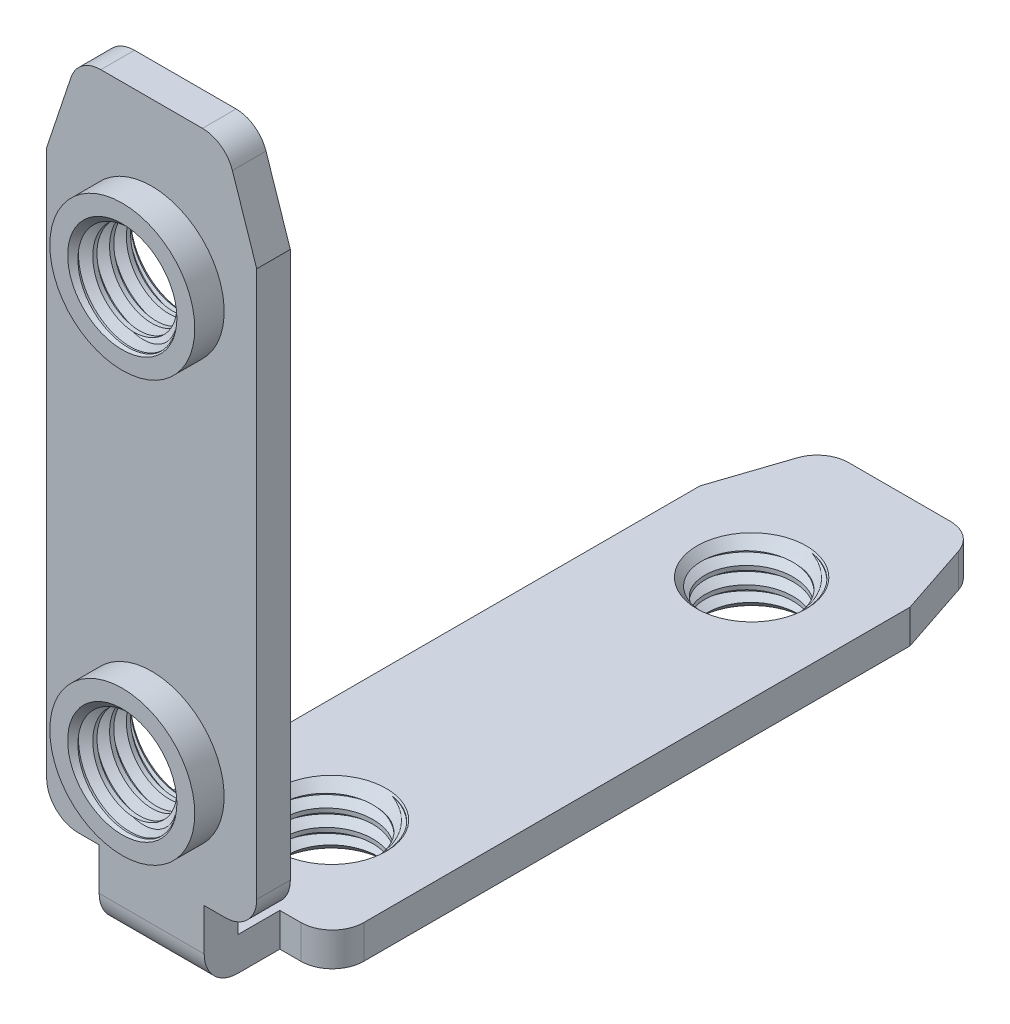
from build123d import *

# Parameters (mm, degrees)
BOSS_EXTRUDE1_DEPTH      = 1.6
SKETCH2_R                = 3.45
BOSS_EXTRUDE2_DEPTH      = 1.4
SKETCH10_R               = 2.1
CUT_EXTRUDE1_DEPTH       = 35.496376621
CHAMFER1_SIZE            = 0.5
BOSS_EXTRUDE3_DEPTH      = 5
CHAMFER1_OF_MIRROR4_SIZE = 0.5
THREAD1_PITCH            = 0.8
THREAD2_PITCH            = 0.8
THREAD3_PITCH            = 0.8
THREAD4_PITCH            = 0.8


with BuildPart() as part:
    # Sketch1 → Boss-Extrude1 (new body)
    with BuildSketch(Plane.XY):
        with BuildLine():
            Line((-3.5, 2), (-2.5, 2))
            Line((-2.5, 2), (-2.5, 0))
            Line((-2.5, 0), (2.5, 0))
            Line((2.5, 0), (2.5, 2))
            Line((2.5, 2), (3.5, 2))
            ThreePointArc((3.5, 2), (4.560660172, 2.439339828), (5, 3.5))
            Line((5, 3.5), (5, 29.5))
            Line((5, 29.5), (3.841886117, 32.974341649))
            ThreePointArc((3.841886117, 32.974341649), (3.295926597, 33.716863278), (2.41886117, 34))
            Line((2.41886117, 34), (-2.41886117, 34))
            ThreePointArc((-2.41886117, 34), (-3.295926597, 33.716863278), (-3.841886117, 32.974341649))
            Line((-3.841886117, 32.974341649), (-5, 29.5))
            Line((-5, 29.5), (-5, 3.5))
            ThreePointArc((-5, 3.5), (-4.560660172, 2.439339828), (-3.5, 2))
        make_face()
    boss_extrude1 = extrude(amount=BOSS_EXTRUDE1_DEPTH)

    # Sketch2 → Boss-Extrude2 (add)
    with BuildSketch(Plane.XY.offset(1.6)):
        with Locations(Location((0, 6.96, 0), (0, 0, 180))):
            Circle(SKETCH2_R)
        with Locations(Location((0, 26.96, 0), (0, 0, 180))):
            Circle(SKETCH2_R)
    boss_extrude2 = extrude(amount=BOSS_EXTRUDE2_DEPTH)

    # Sketch10 → Cut-Extrude1 (cut, through all)
    with BuildSketch(Plane.XY.offset(3)):
        with Locations((0, 6.96)):
            Circle(SKETCH10_R)
        with Locations((0, 26.96)):
            Circle(SKETCH10_R)
    cut_extrude1 = extrude(amount=-CUT_EXTRUDE1_DEPTH, mode=Mode.SUBTRACT)

    # Chamfer1
    chamfer1_edges = [part.edges().sort_by_distance(p)[0] for p in [
        (-2.1, 6.96, 0),
        (-2.1, 6.96, 3),
        (-2.1, 26.96, 0),
        (-2.1, 26.96, 3),
    ]]
    chamfer(chamfer1_edges, length=CHAMFER1_SIZE)

    # Sketch5 → Boss-Extrude3 (add)
    with BuildSketch(Plane(origin=(2.5, 0, 0), x_dir=(0, 0, -1), z_dir=(1, 0, 0))):
        with BuildLine():
            Line((0, 0), (-1.6, 0))
            ThreePointArc((-1.6, 0), (-1.13137085, -1.13137085), (0, -1.6))
            Line((0, -1.6), (0, 0))
        make_face()
    extrude(amount=-BOSS_EXTRUDE3_DEPTH)

    # Mirror4: Boss-Extrude1, Boss-Extrude2, Cut-Extrude1 across plane
    add(boss_extrude1.mirror(Plane(origin=(0, 0, 0), x_dir=(0, -0.7071067811865465, 0.7071067811865486), z_dir=(0, -0.7071067811865488, -0.7071067811865464))))
    add(boss_extrude2.mirror(Plane(origin=(0, 0, 0), x_dir=(0, -0.7071067811865465, 0.7071067811865486), z_dir=(0, -0.7071067811865488, -0.7071067811865464))))
    add(cut_extrude1.mirror(Plane(origin=(0, 0, 0), x_dir=(0, -0.7071067811865465, 0.7071067811865486), z_dir=(0, -0.7071067811865488, -0.7071067811865464))), mode=Mode.SUBTRACT)

    # Chamfer1 of Mirror4
    chamfer1_of_mirror4_edges = [part.edges().sort_by_distance(p)[0] for p in [
        (-2.1, 0, -6.96),
        (-2.1, -3, -6.96),
        (-2.1, 0, -26.96),
        (-2.1, -3, -26.96),
    ]]
    chamfer(chamfer1_of_mirror4_edges, length=CHAMFER1_OF_MIRROR4_SIZE)

    # Thread1: arcs per turn and ends read off the stored shape
    # Thread1: the profile of Thread Profile2 profile screwed along a right-hand helix through 6.25 turns, 8 arcs to a turn; built about Z, then put on its axis
    thread1_z = Axis((0, 0, 0), (0, 0, 1))
    thread1_corners = [(2.0997, 0, -0.000173205), (2.5330127, 0, 0.249999999), (2.5330127, 0, 0.349999999), (2.0997, 0, 0.600173203)]
    with BuildLine(mode=Mode.PRIVATE) as thread1_profile:
        Line(thread1_corners[0], thread1_corners[1])
        Line(thread1_corners[1], thread1_corners[2])
        Line(thread1_corners[2], thread1_corners[3])
        Line(thread1_corners[3], thread1_corners[0])
    thread1_cap = Face(thread1_profile.wire())
    thread1_turn_angles = [0, 22.5, 45, 67.5, 90, 112.5, 135, 157.5, 180, 202.5, 225, 247.5, 270, 292.5, 315, 337.5, 360]
    thread1_turn_weights = [1, 0.9238795325112867, 1, 0.9238795325112867, 1, 0.9238795325112867, 1, 0.9238795325112867, 1, 0.9238795325112867, 1, 0.9238795325112867, 1, 0.9238795325112867, 1, 0.9238795325112867, 1]
    thread1_turn_rails = [Edge.make_bspline([Vector(p[0], p[1], 0).rotate(thread1_z, thread1_turn_angles[k]) / thread1_turn_weights[k] + Vector(0, 0, p[2] + THREAD1_PITCH * thread1_turn_angles[k] / 360) for k in range(17)], [0, 0, 0, 1, 1, 2, 2, 3, 3, 4, 4, 5, 5, 6, 6, 7, 7, 8, 8, 8], 2, thread1_turn_weights) for p in thread1_corners]
    thread1_turn_sides = [Face.make_surface_from_curves(thread1_turn_rails[p[0]], thread1_turn_rails[p[1]]) for p in [(0, 1), (1, 2), (2, 3), (3, 0)]]
    thread1_last_angles = [2160, 2182.5, 2205, 2227.5, 2250]
    thread1_last_weights = [1, 0.9238795325112867, 1, 0.9238795325112867, 1]
    thread1_last_rails = [Edge.make_bspline([Vector(p[0], p[1], 0).rotate(thread1_z, thread1_last_angles[k]) / thread1_last_weights[k] + Vector(0, 0, p[2] + THREAD1_PITCH * thread1_last_angles[k] / 360) for k in range(5)], [0, 0, 0, 1, 1, 2, 2, 2], 2, thread1_last_weights) for p in thread1_corners]
    thread1_last_sides = [Face.make_surface_from_curves(thread1_last_rails[p[0]], thread1_last_rails[p[1]]) for p in [(0, 1), (1, 2), (2, 3), (3, 0)]]
    thread1 = Plane(origin=(0, 26.96, -0.5), x_dir=(1, 0, 0), z_dir=(0, 0, 1)) * Solid(Shell([*[p.moved(Location((0, 0, THREAD1_PITCH * i))) for i in range(6) for p in thread1_turn_sides], *thread1_last_sides, thread1_cap, thread1_cap.rotate(thread1_z, 2250).moved(Location((0, 0, THREAD1_PITCH * 2250 / 360)))]))
    add(thread1, mode=Mode.SUBTRACT)

    # Thread2: arcs per turn and ends read off the stored shape
    # Thread2: the profile of Thread Profile3 profile screwed along a right-hand helix through 6.25 turns, 8 arcs to a turn; built about Z, then put on its axis
    thread2_z = Axis((0, 0, 0), (0, 0, 1))
    thread2_corners = [(2.0997, 0, -0.000173205), (2.5330127, 0, 0.249999999), (2.5330127, 0, 0.349999999), (2.0997, 0, 0.600173203)]
    with BuildLine(mode=Mode.PRIVATE) as thread2_profile:
        Line(thread2_corners[0], thread2_corners[1])
        Line(thread2_corners[1], thread2_corners[2])
        Line(thread2_corners[2], thread2_corners[3])
        Line(thread2_corners[3], thread2_corners[0])
    thread2_cap = Face(thread2_profile.wire())
    thread2_turn_angles = [0, 22.5, 45, 67.5, 90, 112.5, 135, 157.5, 180, 202.5, 225, 247.5, 270, 292.5, 315, 337.5, 360]
    thread2_turn_weights = [1, 0.9238795325112867, 1, 0.9238795325112867, 1, 0.9238795325112867, 1, 0.9238795325112867, 1, 0.9238795325112867, 1, 0.9238795325112867, 1, 0.9238795325112867, 1, 0.9238795325112867, 1]
    thread2_turn_rails = [Edge.make_bspline([Vector(p[0], p[1], 0).rotate(thread2_z, thread2_turn_angles[k]) / thread2_turn_weights[k] + Vector(0, 0, p[2] + THREAD2_PITCH * thread2_turn_angles[k] / 360) for k in range(17)], [0, 0, 0, 1, 1, 2, 2, 3, 3, 4, 4, 5, 5, 6, 6, 7, 7, 8, 8, 8], 2, thread2_turn_weights) for p in thread2_corners]
    thread2_turn_sides = [Face.make_surface_from_curves(thread2_turn_rails[p[0]], thread2_turn_rails[p[1]]) for p in [(0, 1), (1, 2), (2, 3), (3, 0)]]
    thread2_last_angles = [2160, 2182.5, 2205, 2227.5, 2250]
    thread2_last_weights = [1, 0.9238795325112867, 1, 0.9238795325112867, 1]
    thread2_last_rails = [Edge.make_bspline([Vector(p[0], p[1], 0).rotate(thread2_z, thread2_last_angles[k]) / thread2_last_weights[k] + Vector(0, 0, p[2] + THREAD2_PITCH * thread2_last_angles[k] / 360) for k in range(5)], [0, 0, 0, 1, 1, 2, 2, 2], 2, thread2_last_weights) for p in thread2_corners]
    thread2_last_sides = [Face.make_surface_from_curves(thread2_last_rails[p[0]], thread2_last_rails[p[1]]) for p in [(0, 1), (1, 2), (2, 3), (3, 0)]]
    thread2 = Plane(origin=(0, 6.96, -0.5), x_dir=(1, 0, 0), z_dir=(0, 0, 1)) * Solid(Shell([*[p.moved(Location((0, 0, THREAD2_PITCH * i))) for i in range(6) for p in thread2_turn_sides], *thread2_last_sides, thread2_cap, thread2_cap.rotate(thread2_z, 2250).moved(Location((0, 0, THREAD2_PITCH * 2250 / 360)))]))
    add(thread2, mode=Mode.SUBTRACT)

    # Thread3: arcs per turn and ends read off the stored shape
    # Thread3: the profile of Thread Profile4 profile screwed along a right-hand helix through 6.25 turns, 8 arcs to a turn; built about Z, then put on its axis
    thread3_z = Axis((0, 0, 0), (0, 0, 1))
    thread3_corners = [(2.0997, 0, -0.000173205), (2.5330127, 0, 0.249999999), (2.5330127, 0, 0.349999999), (2.0997, 0, 0.600173203)]
    with BuildLine(mode=Mode.PRIVATE) as thread3_profile:
        Line(thread3_corners[0], thread3_corners[1])
        Line(thread3_corners[1], thread3_corners[2])
        Line(thread3_corners[2], thread3_corners[3])
        Line(thread3_corners[3], thread3_corners[0])
    thread3_cap = Face(thread3_profile.wire())
    thread3_turn_angles = [0, 22.5, 45, 67.5, 90, 112.5, 135, 157.5, 180, 202.5, 225, 247.5, 270, 292.5, 315, 337.5, 360]
    thread3_turn_weights = [1, 0.9238795325112867, 1, 0.9238795325112867, 1, 0.9238795325112867, 1, 0.9238795325112867, 1, 0.9238795325112867, 1, 0.9238795325112867, 1, 0.9238795325112867, 1, 0.9238795325112867, 1]
    thread3_turn_rails = [Edge.make_bspline([Vector(p[0], p[1], 0).rotate(thread3_z, thread3_turn_angles[k]) / thread3_turn_weights[k] + Vector(0, 0, p[2] + THREAD3_PITCH * thread3_turn_angles[k] / 360) for k in range(17)], [0, 0, 0, 1, 1, 2, 2, 3, 3, 4, 4, 5, 5, 6, 6, 7, 7, 8, 8, 8], 2, thread3_turn_weights) for p in thread3_corners]
    thread3_turn_sides = [Face.make_surface_from_curves(thread3_turn_rails[p[0]], thread3_turn_rails[p[1]]) for p in [(0, 1), (1, 2), (2, 3), (3, 0)]]
    thread3_last_angles = [2160, 2182.5, 2205, 2227.5, 2250]
    thread3_last_weights = [1, 0.9238795325112867, 1, 0.9238795325112867, 1]
    thread3_last_rails = [Edge.make_bspline([Vector(p[0], p[1], 0).rotate(thread3_z, thread3_last_angles[k]) / thread3_last_weights[k] + Vector(0, 0, p[2] + THREAD3_PITCH * thread3_last_angles[k] / 360) for k in range(5)], [0, 0, 0, 1, 1, 2, 2, 2], 2, thread3_last_weights) for p in thread3_corners]
    thread3_last_sides = [Face.make_surface_from_curves(thread3_last_rails[p[0]], thread3_last_rails[p[1]]) for p in [(0, 1), (1, 2), (2, 3), (3, 0)]]
    thread3 = Plane(origin=(0, 0.5, -6.96), x_dir=(-1, 0, 0), z_dir=(0, -1, 0)) * Solid(Shell([*[p.moved(Location((0, 0, THREAD3_PITCH * i))) for i in range(6) for p in thread3_turn_sides], *thread3_last_sides, thread3_cap, thread3_cap.rotate(thread3_z, 2250).moved(Location((0, 0, THREAD3_PITCH * 2250 / 360)))]))
    add(thread3, mode=Mode.SUBTRACT)

    # Thread4: arcs per turn and ends read off the stored shape
    # Thread4: the profile of Thread Profile5 profile screwed along a right-hand helix through 6.25 turns, 8 arcs to a turn; built about Z, then put on its axis
    thread4_z = Axis((0, 0, 0), (0, 0, 1))
    thread4_corners = [(2.0997, 0, -0.000173205), (2.5330127, 0, 0.249999999), (2.5330127, 0, 0.349999999), (2.0997, 0, 0.600173203)]
    with BuildLine(mode=Mode.PRIVATE) as thread4_profile:
        Line(thread4_corners[0], thread4_corners[1])
        Line(thread4_corners[1], thread4_corners[2])
        Line(thread4_corners[2], thread4_corners[3])
        Line(thread4_corners[3], thread4_corners[0])
    thread4_cap = Face(thread4_profile.wire())
    thread4_turn_angles = [0, 22.5, 45, 67.5, 90, 112.5, 135, 157.5, 180, 202.5, 225, 247.5, 270, 292.5, 315, 337.5, 360]
    thread4_turn_weights = [1, 0.9238795325112867, 1, 0.9238795325112867, 1, 0.9238795325112867, 1, 0.9238795325112867, 1, 0.9238795325112867, 1, 0.9238795325112867, 1, 0.9238795325112867, 1, 0.9238795325112867, 1]
    thread4_turn_rails = [Edge.make_bspline([Vector(p[0], p[1], 0).rotate(thread4_z, thread4_turn_angles[k]) / thread4_turn_weights[k] + Vector(0, 0, p[2] + THREAD4_PITCH * thread4_turn_angles[k] / 360) for k in range(17)], [0, 0, 0, 1, 1, 2, 2, 3, 3, 4, 4, 5, 5, 6, 6, 7, 7, 8, 8, 8], 2, thread4_turn_weights) for p in thread4_corners]
    thread4_turn_sides = [Face.make_surface_from_curves(thread4_turn_rails[p[0]], thread4_turn_rails[p[1]]) for p in [(0, 1), (1, 2), (2, 3), (3, 0)]]
    thread4_last_angles = [2160, 2182.5, 2205, 2227.5, 2250]
    thread4_last_weights = [1, 0.9238795325112867, 1, 0.9238795325112867, 1]
    thread4_last_rails = [Edge.make_bspline([Vector(p[0], p[1], 0).rotate(thread4_z, thread4_last_angles[k]) / thread4_last_weights[k] + Vector(0, 0, p[2] + THREAD4_PITCH * thread4_last_angles[k] / 360) for k in range(5)], [0, 0, 0, 1, 1, 2, 2, 2], 2, thread4_last_weights) for p in thread4_corners]
    thread4_last_sides = [Face.make_surface_from_curves(thread4_last_rails[p[0]], thread4_last_rails[p[1]]) for p in [(0, 1), (1, 2), (2, 3), (3, 0)]]
    thread4 = Plane(origin=(0, 0.5, -26.96), x_dir=(-1, 0, 0), z_dir=(0, -1, 0)) * Solid(Shell([*[p.moved(Location((0, 0, THREAD4_PITCH * i))) for i in range(6) for p in thread4_turn_sides], *thread4_last_sides, thread4_cap, thread4_cap.rotate(thread4_z, 2250).moved(Location((0, 0, THREAD4_PITCH * 2250 / 360)))]))
    add(thread4, mode=Mode.SUBTRACT)


solid = part.part
